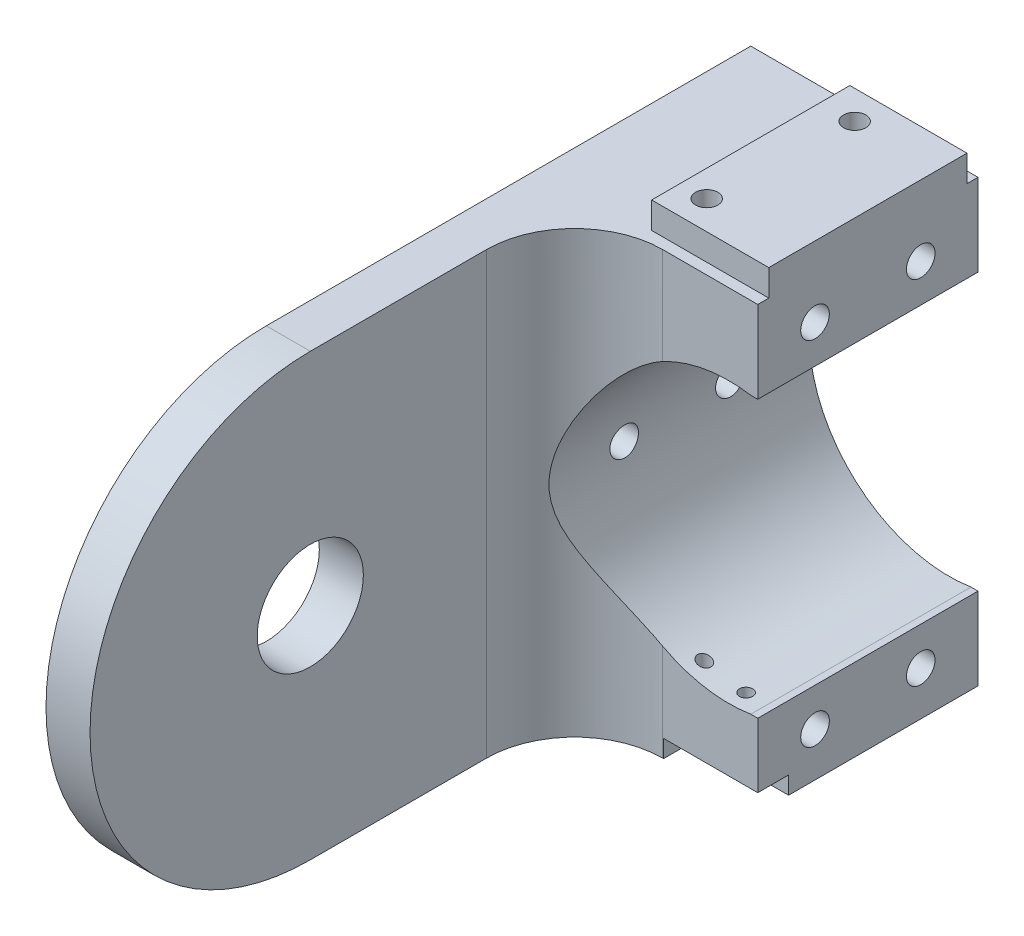
from build123d import *

# Parameters (mm, degrees)
CENTRE_HOLE_FOR_L2_DEPTH      = 40
CENTRE_HOLE_FOR_L2_DEPTH_BACK = 10
SKETCH1_R                     = 39.1
SKETCH1_R_2                   = 31.75
MAIN_STRUCTURE_DEPTH          = 60
MAIN_STRUCTURE_DEPTH_BACK     = 50
SKETCH2_W                     = 90
SKETCH2_H                     = 100
SKETCH2_R                     = 31.75
BEARING_CURVE_DEPTH           = 10
SKETCH6_R                     = 10.5
SHAFT_HOLE_DEPTH              = 10
WRIST_CUTOUT_DEPTH            = 186.809041761
SURFACECUT1_START             = 5
SURFACECUT1_OUTLINE_R         = 10.5
SURFACECUT1_DEPTH             = 40
SKETCH11_W                    = 25
SKETCH11_H                    = 45
SKETCH11_R                    = 2.525
BOSS_EXTRUDE1_DEPTH           = 6
SKETCH15_W                    = 19.8
SKETCH15_H                    = 7
CUT_EXTRUDE4_DEPTH            = 4
CUT_EXTRUDE5_REACH            = 188.893
CUT_EXTRUDE5_END_RADIUS       = 31.75
SKETCH16_R                    = 1.5
CUT_EXTRUDE6_DEPTH            = 168.7378908
CUT_EXTRUDE6_DEPTH_BACK       = 168.7378908
SKETCH18_R                    = 3.25
SKETCH19_R                    = 3.25
CUT_EXTRUDE7_DEPTH            = 168.7378908
SKETCH9_R                     = 12.05
CUT_EXTRUDE8_DEPTH            = 10
SKETCH20_R                    = 3.25
SKETCH20_W                    = 45
SKETCH20_H                    = 6
BOSS_EXTRUDE2_DEPTH           = 1.5875


# Read off the part's stored shape, not the designer's step: SurfaceCut1
with BuildPart() as part:
    # Sketch1 → Centre Hole for L2 (new, two sides: drawn at the far end of the back side and taken through both)
    with BuildSketch(Plane.XY.offset(-CENTRE_HOLE_FOR_L2_DEPTH_BACK)):
        Circle(SKETCH1_R)
        Circle(SKETCH1_R_2, mode=Mode.SUBTRACT)
    extrude(amount=CENTRE_HOLE_FOR_L2_DEPTH + CENTRE_HOLE_FOR_L2_DEPTH_BACK)


with BuildPart() as body_2:
    # Sketch2 → Main Structure (new, two sides: drawn at the far end of the back side and taken through both)
    with BuildSketch(Plane.XY.offset(40).offset(-MAIN_STRUCTURE_DEPTH_BACK)):
        Rectangle(SKETCH2_W, SKETCH2_H)
        Circle(SKETCH2_R, mode=Mode.SUBTRACT)
    extrude(amount=MAIN_STRUCTURE_DEPTH + MAIN_STRUCTURE_DEPTH_BACK)

    # Sketch3 → Bearing Curve (add)
    with BuildSketch(Plane.ZY.offset(45)):
        with BuildLine():
            Line((100, 50), (100, -50))
            ThreePointArc((100, -50), (150, 0), (100, 50))
        make_face()
    bearing_curve = extrude(amount=-BEARING_CURVE_DEPTH)

    # Upright Mirror: Bearing Curve across plane
    add(bearing_curve.mirror(Plane(origin=(0, 0, 0), x_dir=(0, 0, 1), z_dir=(1, 0, 0))))

    # Sketch6 → Shaft Hole (cut)
    with BuildSketch(Plane.ZY.offset(45)):
        with Locations((100, 0)):
            Circle(SKETCH6_R)
    shaft_hole = extrude(amount=-SHAFT_HOLE_DEPTH, mode=Mode.SUBTRACT)

    # Sketch4 → Wrist Cutout (cut, through all)
    with BuildSketch(Plane(origin=(0, 50, 0), x_dir=(1, 0, 0), z_dir=(0, 1, 0))):
        with BuildLine():
            Line((-35, -100), (-35, -60))
            ThreePointArc((-35, -60), (-29.142135624, -45.857864376), (-15, -40))
            Line((-15, -40), (15, -40))
            ThreePointArc((15, -40), (29.142135624, -45.857864376), (35, -60))
            Line((35, -60), (35, -100))
            Line((35, -100), (-35, -100))
        make_face()
    extrude(amount=-WRIST_CUTOUT_DEPTH, mode=Mode.SUBTRACT)

    # Bearing Mirror: Shaft Hole across plane
    add(shaft_hole.mirror(Plane(origin=(0, 0, 0), x_dir=(0, 0, 1), z_dir=(1, 0, 0))), mode=Mode.SUBTRACT)


with BuildPart() as surfacecut1_tool:
    # SurfaceCut1 outline → SurfaceCut1 (new body)
    with BuildSketch(Plane.YZ.offset(SURFACECUT1_START)):
        with BuildLine():
            ThreePointArc((50, 100), (0, 150), (-50, 100))
            Line((-50, 100), (-50, -10))
            Line((-50, -10), (50, -10))
            Line((50, -10), (50, 100))
        make_face()
        with Locations((0, 100)):
            Circle(SURFACECUT1_OUTLINE_R, mode=Mode.SUBTRACT)
    extrude(amount=SURFACECUT1_DEPTH)


with BuildPart() as part_1:
    add(part.part)

    # SurfaceCut1: cut by surfacecut1_tool
    add(surfacecut1_tool.part, mode=Mode.SUBTRACT)


with BuildPart() as body_2_1:
    add(body_2.part)

    # SurfaceCut1: cut by surfacecut1_tool
    add(surfacecut1_tool.part, mode=Mode.SUBTRACT)

    # Sketch15 → Cut-Extrude4 (cut)
    with BuildSketch(Plane(origin=(0, -50, 0), x_dir=(-1, 0, 0), z_dir=(0, -1, 0))):
        with Locations((4.9, -36.5)):
            Rectangle(SKETCH15_W, SKETCH15_H)
    extrude(amount=-CUT_EXTRUDE4_DEPTH, mode=Mode.SUBTRACT)


with BuildPart() as body_3:
    # Sketch11 → Boss-Extrude1 (new body)
    with BuildSketch(Plane(origin=(0, 50, 0), x_dir=(1, 0, 0), z_dir=(0, 1, 0))):
        with Locations((-7.5, -15)):
            Rectangle(SKETCH11_W, SKETCH11_H)
        with Locations(Location((-12.4125, 1, 0), (0, 0, 270))):
            Circle(SKETCH11_R, mode=Mode.SUBTRACT)
        with Locations(Location((-14, -31, 0), (0, 0, 270))):
            Circle(SKETCH11_R, mode=Mode.SUBTRACT)
    extrude(amount=BOSS_EXTRUDE1_DEPTH)


with BuildPart() as cut_extrude5_tool:
    # Cut-Extrude5: up to this cylinder (the profile starts outside it)
    cut_extrude5_end = Plane(origin=(0, 0, 35.9), z_dir=(0, 0, 1)) * Cylinder(CUT_EXTRUDE5_END_RADIUS, 442.286, mode=Mode.PRIVATE)
    # Sketch16 → Cut-Extrude5 (new, up to the surface)
    with BuildSketch(Plane(origin=(0, -46, 0), x_dir=(-1, 0, 0), z_dir=(0, -1, 0)), mode=Mode.PRIVATE) as cut_extrude5_sk1:
        with Locations(Location((9.65, -35.9, 0), (0, 0, 90))):
            Circle(SKETCH16_R)
    cut_extrude5_tool1 = extrude(cut_extrude5_sk1.sketch, amount=-CUT_EXTRUDE5_REACH, mode=Mode.PRIVATE) - cut_extrude5_end
    add(cut_extrude5_tool1.solids().sort_by_distance((-9.65, -46, 35.9))[0])
    # Sketch16 → Cut-Extrude5 (new, up to the surface)
    with BuildSketch(Plane(origin=(0, -46, 0), x_dir=(-1, 0, 0), z_dir=(0, -1, 0)), mode=Mode.PRIVATE) as cut_extrude5_sk2:
        with Locations(Location((0.15, -35.9, 0), (0, 0, 90))):
            Circle(SKETCH16_R)
    cut_extrude5_tool2 = extrude(cut_extrude5_sk2.sketch, amount=-CUT_EXTRUDE5_REACH, mode=Mode.PRIVATE) - cut_extrude5_end
    add(cut_extrude5_tool2.solids().sort_by_distance((-0.15, -46, 35.9))[0])


with BuildPart() as part_2:
    add(part_1.part)

    # Cut-Extrude5: cut by cut_extrude5_tool
    add(cut_extrude5_tool.part, mode=Mode.SUBTRACT)


with BuildPart() as body_2_2:
    add(body_2_1.part)

    # Cut-Extrude5: cut by cut_extrude5_tool
    add(cut_extrude5_tool.part, mode=Mode.SUBTRACT)


with BuildPart() as cut_extrude6_tool:
    # Sketch18 → Cut-Extrude6 (new, two sides: drawn at the far end of the back side and taken through both)
    with BuildSketch(Plane.ZY.offset(45).offset(-CUT_EXTRUDE6_DEPTH_BACK)):
        with Locations((8, 0)):
            Circle(SKETCH18_R)
        with Locations((32, 0)):
            Circle(SKETCH18_R)
    extrude(amount=CUT_EXTRUDE6_DEPTH + CUT_EXTRUDE6_DEPTH_BACK)


with BuildPart() as part_3:
    add(part_2.part)

    # Cut-Extrude6: cut by cut_extrude6_tool
    add(cut_extrude6_tool.part, mode=Mode.SUBTRACT)


with BuildPart() as body_2_3:
    add(body_2_2.part)

    # Cut-Extrude6: cut by cut_extrude6_tool
    add(cut_extrude6_tool.part, mode=Mode.SUBTRACT)


with BuildPart() as cut_extrude7_tool:
    # Sketch19 → Cut-Extrude7 (new, through all)
    with BuildSketch(Plane.ZY.offset(45)):
        with Locations((32, 0)):
            Circle(SKETCH19_R)
        with Locations((8, 0)):
            Circle(SKETCH19_R)
        with Locations((3, 40)):
            Circle(SKETCH19_R)
        with Locations((27, 40)):
            Circle(SKETCH19_R)
        with Locations((3, -40)):
            Circle(SKETCH19_R)
        with Locations((27, -40)):
            Circle(SKETCH19_R)
    extrude(amount=-CUT_EXTRUDE7_DEPTH)


with BuildPart() as part_4:
    add(part_3.part)

    # Cut-Extrude7: cut by cut_extrude7_tool
    add(cut_extrude7_tool.part, mode=Mode.SUBTRACT)



with BuildPart() as body_2_4:
    add(body_2_3.part)

    # Cut-Extrude7: cut by cut_extrude7_tool
    add(cut_extrude7_tool.part, mode=Mode.SUBTRACT)

    # Sketch9 → Cut-Extrude8 (cut)
    with BuildSketch(Plane(origin=(-35, 0, 0), x_dir=(0, 0, -1), z_dir=(1, 0, 0))):
        with Locations((-100, 0)):
            Circle(SKETCH9_R)
    extrude(amount=-CUT_EXTRUDE8_DEPTH, mode=Mode.SUBTRACT)


with BuildPart() as part_5:
    add(part_4.part)

    add(body_2_4.part)  # Boss-Extrude2 merges body 2

    add(body_3.part)  # Boss-Extrude2 merges body 3
    # Sketch20 → Boss-Extrude2 (add)
    # profile 1 of 3: a face of its own
    with BuildSketch(Plane(origin=(5, 0, 0), x_dir=(0, 0, -1), z_dir=(1, 0, 0))):
        Polygon((-40, 50), (-40, 38.778989157), (-40, 31.353827518), (10, 31.353827518), (10, 38.778989157), (10, 50), (7.5, 50), (-37.5, 50), align=None)
        with Locations(Location((-27, 40, 0), (0, 0, 180))):
            Circle(SKETCH20_R, mode=Mode.SUBTRACT)
        with Locations(Location((-3, 40, 0), (0, 0, 180))):
            Circle(SKETCH20_R, mode=Mode.SUBTRACT)
    # profile 2 of 3: a face of its own
    with BuildSketch(Plane(origin=(5, 0, 0), x_dir=(0, 0, -1), z_dir=(1, 0, 0))):
        with Locations((-15, 53)):
            Rectangle(SKETCH20_W, SKETCH20_H)
    # profile 3 of 3: a face of its own
    with BuildSketch(Plane(origin=(5, 0, 0), x_dir=(0, 0, -1), z_dir=(1, 0, 0))):
        Polygon((10, -50), (10, -38.778989157), (10, -31.353827518), (-40, -31.353827518), (-40, -38.778989157), (-40, -46), (-33, -46), (-33, -50), align=None)
        with Locations(Location((-27, -40, 0), (0, 0, 180))):
            Circle(SKETCH20_R, mode=Mode.SUBTRACT)
        with Locations(Location((-3, -40, 0), (0, 0, 180))):
            Circle(SKETCH20_R, mode=Mode.SUBTRACT)
    extrude(amount=BOSS_EXTRUDE2_DEPTH)


solid = part_5.part
